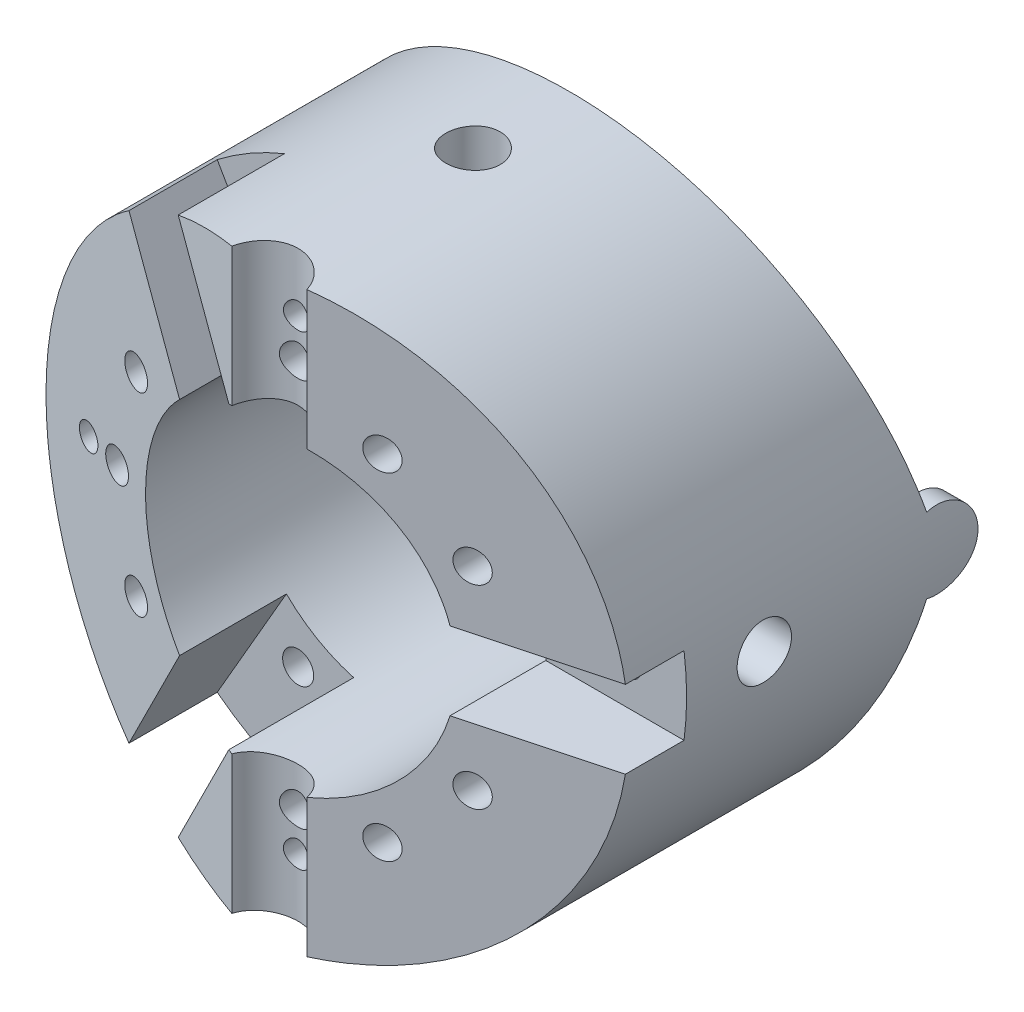
from build123d import *
from build123d.topology import SkipClean

# Parameters (mm, degrees)
SKETCH_1_R                       = 7.5
EXTRUDE_1_DEPTH                  = 10
CUT_EXTRUDE_1_DEPTH              = 15.577379737
CUT_EXTRUDE_1_DEPTH_BACK         = 15.577379737
CUT_EXTRUDE_2_DEPTH              = 15.577379737
CUT_EXTRUDE_2_DEPTH_BACK         = 15.577379737
EXTRUDE_2_REACH                  = 16.577
EXTRUDE_2_END_RADIUS             = 7.5
SKETCH_6_R                       = 1
EXTRUDE_2_DIRECTION_2_REACH      = 16.577
EXTRUDE_2_DIRECTION_2_END_RADIUS = 7.5
CUT_EXTRUDE_7_DEPTH              = 15.577379909
CUT_EXTRUDE_7_DEPTH_BACK         = 15.577379909
SKETCH_7_R                       = 1
CUT_EXTRUDE_9_DEPTH              = 15.401062864
CUT_EXTRUDE_9_DEPTH_BACK         = 15.401062864
SKETCH_8_R                       = 4
CUT_EXTRUDE_10_DEPTH             = 15.401062882
CUT_EXTRUDE_10_DEPTH_BACK        = 15.401062882
SKETCH_9_R                       = 0.4
CUT_EXTRUDE_11_DEPTH             = 15.401062882
CUT_EXTRUDE_11_DEPTH_BACK        = 15.401062882
SKETCH_10_R                      = 0.325
SKETCH_11_W                      = 2.5
SKETCH_11_H                      = 2
CUT_EXTRUDE_12_DEPTH             = 1
SKETCH_12_R                      = 0.7
CUT_EXTRUDE_13_DEPTH             = 1.5
PATTERN_CIRCULAR_1_COUNT         = 4
SKETCH_15_W                      = 7.306857869
SKETCH_15_H                      = 2
CUT_EXTRUDE_14_DEPTH             = 3.5
PATTERN_CIRCULAR_2_COUNT         = 3


with BuildPart() as part:
    # 草图1 → 凸台-拉伸1 (new body)
    with BuildSketch(Plane.XY):
        Circle(SKETCH_1_R)
    extrude(amount=EXTRUDE_1_DEPTH)

    # 草图2 → 切除-拉伸1 (cut, two sides: drawn at the far end of the back side and taken through both)
    with BuildSketch(Plane(origin=(0, 0, 0), x_dir=(0, 0, -1), z_dir=(1, 0, 0)).offset(-CUT_EXTRUDE_1_DEPTH_BACK)):
        Polygon((-2.009618943, 7.5), (0, 0), (0, 7.5), align=None)
        Polygon((0, -7.5), (0, 0), (-2.009618943, -7.5), align=None)
    extrude(amount=CUT_EXTRUDE_1_DEPTH + CUT_EXTRUDE_1_DEPTH_BACK, mode=Mode.SUBTRACT)

    # 草图3 → 切除-拉伸2 (cut, two sides: drawn at the far end of the back side and taken through both)
    with BuildSketch(Plane(origin=(0, 0, 0), x_dir=(1, 0, 0), z_dir=(0, 1, 0)).offset(-CUT_EXTRUDE_2_DEPTH_BACK)):
        Polygon((7.5, -7.990381057), (0, -10), (7.5, -10), align=None)
        Polygon((-7.5, -10), (0, -10), (-7.5, -7.990381057), align=None)
    extrude(amount=CUT_EXTRUDE_2_DEPTH + CUT_EXTRUDE_2_DEPTH_BACK, mode=Mode.SUBTRACT)

    # 凸台-拉伸2: up to this cylinder (the profile starts inside it)
    extrude_2_end = Plane(origin=(0, 0, 0), z_dir=(0, 0, -1)) * Cylinder(EXTRUDE_2_END_RADIUS, 49.154, mode=Mode.PRIVATE)
    # 草图6 → 凸台-拉伸2 (add, up to the surface)
    with BuildSketch(Plane(origin=(0, 0, 0), x_dir=(0, 0, -1), z_dir=(1, 0, 0)), mode=Mode.PRIVATE) as extrude_2_sk1:
        Circle(SKETCH_6_R)
    extrude_2_tool1 = extrude(extrude_2_sk1.sketch, amount=-EXTRUDE_2_REACH, mode=Mode.PRIVATE) & extrude_2_end
    add(extrude_2_tool1.solids().sort_by_distance((0, 0, 0))[0])

    # 凸台-拉伸2 direction 2: up to this cylinder (the profile starts inside it)
    with SkipClean():  # the faces are left unmerged after this step: merging them gives an invalid solid
        extrude_2_direction_2_end = Plane(origin=(0, 0, 0), z_dir=(0, 0, -1)) * Cylinder(EXTRUDE_2_DIRECTION_2_END_RADIUS, 49.154, mode=Mode.PRIVATE)
        # 草图6 → 凸台-拉伸2 direction 2 (add, up to the surface)
        with BuildSketch(Plane(origin=(0, 0, 0), x_dir=(0, 0, -1), z_dir=(1, 0, 0)), mode=Mode.PRIVATE) as extrude_2_direction_2_sk1:
            Circle(SKETCH_6_R)
        extrude_2_direction_2_tool1 = extrude(extrude_2_direction_2_sk1.sketch, amount=EXTRUDE_2_DIRECTION_2_REACH, mode=Mode.PRIVATE) & extrude_2_direction_2_end
        add(extrude_2_direction_2_tool1.solids().sort_by_distance((0, 0, 0))[0])
    add(part.part.scale(1), mode=Mode.REPLACE)  # the faces are merged on a copy

    # 草图7 → 切除-拉伸7 (cut, two sides: drawn at the far end of the back side and taken through both)
    with BuildSketch(Plane(origin=(0, 0, 0), x_dir=(1, 0, 0), z_dir=(0, 1, 0)).offset(-CUT_EXTRUDE_7_DEPTH_BACK)):
        with Locations((0, -10)):
            Circle(SKETCH_7_R)
    extrude(amount=CUT_EXTRUDE_7_DEPTH + CUT_EXTRUDE_7_DEPTH_BACK, mode=Mode.SUBTRACT)

    # 草图8 → 切除-拉伸9 (cut, two sides: drawn at the far end of the back side and taken through both)
    with BuildSketch(Plane.XY.offset(-CUT_EXTRUDE_9_DEPTH_BACK)):
        Circle(SKETCH_8_R)
    extrude(amount=CUT_EXTRUDE_9_DEPTH + CUT_EXTRUDE_9_DEPTH_BACK, mode=Mode.SUBTRACT)

    # 草图9 → 切除-拉伸10 (cut, two sides: drawn at the far end of the back side and taken through both)
    with BuildSketch(Plane.XY.offset(-CUT_EXTRUDE_10_DEPTH_BACK)):
        with Locations((-5, 0)):
            Circle(SKETCH_9_R)
        with Locations((-4.330127019, 2.5)):
            Circle(SKETCH_9_R)
        with Locations((-2.5, 4.330127019)):
            Circle(SKETCH_9_R)
        with Locations((0, 5)):
            Circle(SKETCH_9_R)
        with Locations((2.5, 4.330127019)):
            Circle(SKETCH_9_R)
        with Locations((4.330127019, 2.5)):
            Circle(SKETCH_9_R)
        with Locations((5, 0)):
            Circle(SKETCH_9_R)
        with Locations((4.330127019, -2.5)):
            Circle(SKETCH_9_R)
        with Locations((2.5, -4.330127019)):
            Circle(SKETCH_9_R)
        with Locations((0, -5)):
            Circle(SKETCH_9_R)
        with Locations((-2.5, -4.330127019)):
            Circle(SKETCH_9_R)
        with Locations((-4.330127019, -2.5)):
            Circle(SKETCH_9_R)
    extrude(amount=CUT_EXTRUDE_10_DEPTH + CUT_EXTRUDE_10_DEPTH_BACK, mode=Mode.SUBTRACT)

    # 草图10 → 切除-拉伸11 (cut, two sides: drawn at the far end of the back side and taken through both)
    with BuildSketch(Plane.XY.offset(-CUT_EXTRUDE_11_DEPTH_BACK)):
        with Locations((-6, 0)):
            Circle(SKETCH_10_R)
        with Locations((0, 6)):
            Circle(SKETCH_10_R)
        with Locations((6, 0)):
            Circle(SKETCH_10_R)
        with Locations((0, -6)):
            Circle(SKETCH_10_R)
    extrude(amount=CUT_EXTRUDE_11_DEPTH + CUT_EXTRUDE_11_DEPTH_BACK, mode=Mode.SUBTRACT)

    # 草图11 → 切除-拉伸12 (cut)
    with BuildSketch(Plane(origin=(0, 0, -1), x_dir=(-1, 0, 0), z_dir=(0, 0, -1))):
        with Locations((-5.659580399, 0)):
            Rectangle(SKETCH_11_W, SKETCH_11_H)
        with Locations((5.659580399, 0)):
            Rectangle(SKETCH_11_W, SKETCH_11_H)
    extrude(amount=-CUT_EXTRUDE_12_DEPTH, mode=Mode.SUBTRACT)

    # 草图12 → 切除-拉伸13 (cut)
    with BuildSketch(Plane(origin=(0, -7.5, 0), x_dir=(-1, 0, 0), z_dir=(0, -1, 0))):
        with Locations((0, -4.5)):
            Circle(SKETCH_12_R)
    cut_extrude_13 = extrude(amount=-CUT_EXTRUDE_13_DEPTH, mode=Mode.SUBTRACT)

    # 阵列(圆周)1: 切除-拉伸13 ×4 about axis
    pattern_circular_1_axis = Axis((0, 0, 10), (0, 0, -1))
    for i in range(1, PATTERN_CIRCULAR_1_COUNT):
        add(cut_extrude_13.rotate(pattern_circular_1_axis, i * 360 / PATTERN_CIRCULAR_1_COUNT), mode=Mode.SUBTRACT)

    # 草图15 → 切除-拉伸14 (cut)
    with BuildSketch(Plane.XY.offset(10)):
        with Locations((4.439024148, 0)):
            Rectangle(SKETCH_15_W, SKETCH_15_H)
    cut_extrude_14 = extrude(amount=-CUT_EXTRUDE_14_DEPTH, mode=Mode.SUBTRACT)

    # 阵列(圆周)2: 切除-拉伸14 ×3 about axis
    pattern_circular_2_axis = Axis((0, 0, 10), (0, 0, -1))
    for i in range(1, PATTERN_CIRCULAR_2_COUNT):
        add(cut_extrude_14.rotate(pattern_circular_2_axis, i * 360 / PATTERN_CIRCULAR_2_COUNT), mode=Mode.SUBTRACT)


solid = part.part
